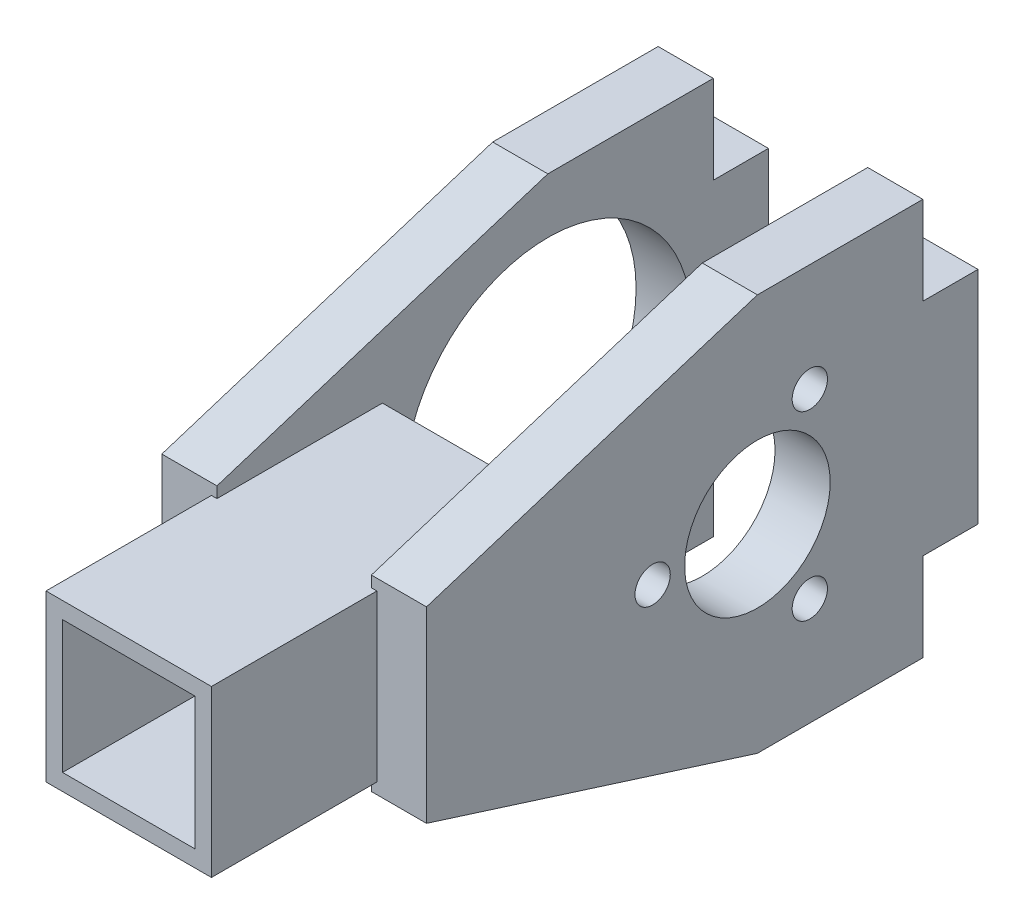
from build123d import *

# Parameters (mm, degrees)
SKETCH_3_R           = 6.6
SKETCH_3_R_2         = 1.6
EXTRUDE_1_DEPTH      = 5
SKETCH_5_R           = 13
EXTRUDE_2_DEPTH      = 5
EXTRUDE_3_DEPTH      = 15
EXTRUDE_3_DEPTH_BACK = 15
SKETCH_6_W           = 15
SKETCH_6_H           = 15
SKETCH_6_W_2         = 12
SKETCH_6_H_2         = 12


with BuildPart() as part:
    # ｽｹｯﾁ3 → ﾎﾞｽ - 押し出し1 (new body)
    with BuildSketch(Plane(origin=(7, 0, 0), x_dir=(0, 0, -1), z_dir=(1, 0, 0))):
        Polygon((5, 10), (5, -10), (0, -10), (0, -18), (-15, -18), (-45, -8.5), (-45, 8.5), (-15, 18), (0, 18), (0, 10), align=None)
        with Locations((-15, 0)):
            Circle(SKETCH_3_R, mode=Mode.SUBTRACT)
        with Locations((-24.5, 0)):
            Circle(SKETCH_3_R_2, mode=Mode.SUBTRACT)
        with Locations((-10.25, 8.227241336)):
            Circle(SKETCH_3_R_2, mode=Mode.SUBTRACT)
        with Locations((-10.25, -8.227241336)):
            Circle(SKETCH_3_R_2, mode=Mode.SUBTRACT)
    extrude(amount=EXTRUDE_1_DEPTH)



with BuildPart() as body_2:
    # ｽｹｯﾁ5 → ﾎﾞｽ - 押し出し2 (new body)
    with BuildSketch(Plane(origin=(-7, 0, 0), x_dir=(0, 0, -1), z_dir=(1, 0, 0))):
        Polygon((-45, -8.5), (-45, 8.5), (-15, 18), (0, 18), (0, 10), (5, 10), (5, -10), (0, -10), (0, -18), (-15, -18), align=None)
        with Locations((-15, 0)):
            Circle(SKETCH_5_R, mode=Mode.SUBTRACT)
    extrude(amount=-EXTRUDE_2_DEPTH)


with BuildPart() as part_1:
    add(part.part)

    add(body_2.part)  # ﾎﾞｽ - 押し出し3 merges body 2
    # ｽｹｯﾁ6 → ﾎﾞｽ - 押し出し3 (add, two sides: drawn at the far end of the back side and taken through both)
    with BuildSketch(Plane.XY.offset(45).offset(-EXTRUDE_3_DEPTH_BACK)):
        Rectangle(SKETCH_6_W, SKETCH_6_H)
        Rectangle(SKETCH_6_W_2, SKETCH_6_H_2, mode=Mode.SUBTRACT)
    extrude(amount=EXTRUDE_3_DEPTH + EXTRUDE_3_DEPTH_BACK)


solid = part_1.part
